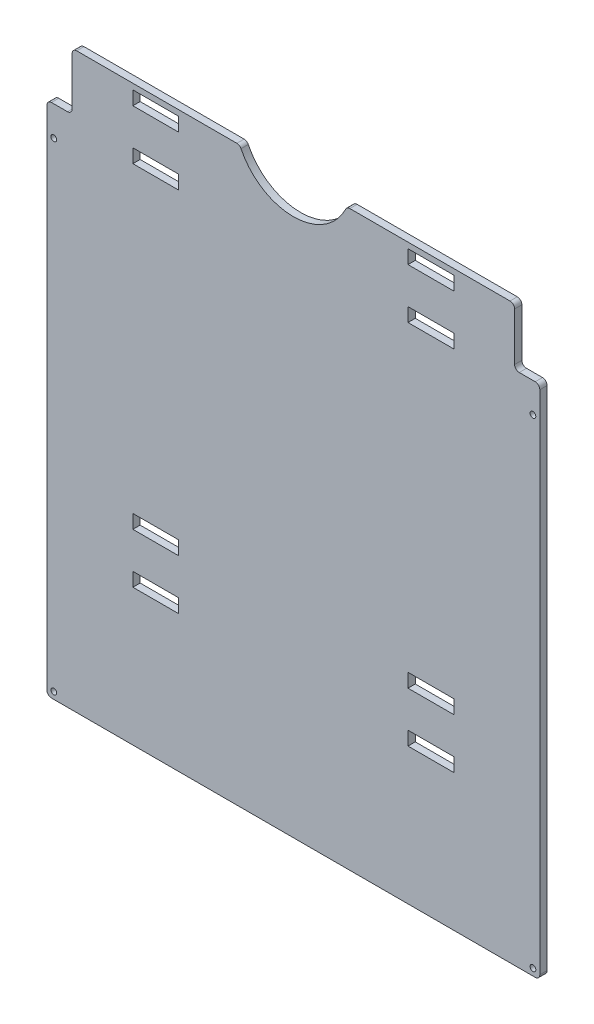
from build123d import *

# Parameters (mm, degrees)
SKETCH1_W                 = 215
SKETCH1_H                 = 250
BOSS_EXTRUDE1_DEPTH       = 3.175
SKETCH2_R                 = 25.4
CUT_EXTRUDE1_DEPTH        = 165.897940027
SKETCH3_W                 = 11
SKETCH3_H                 = 25
CUT_EXTRUDE2_DEPTH        = 165.897940027
FILLET1_R                 = 2
SKETCH4_W                 = 20
SKETCH4_H                 = 6
CUT_EXTRUDE3_DEPTH        = 165.897940027
LPATTERN1_COUNT           = 2
LPATTERN1_PITCH           = 160
LPATTERN1_COPY_1_SKETCH_W = 20
LPATTERN1_COPY_1_SKETCH_H = 6
LPATTERN1_COPY_1_DEPTH    = 165.897940027
M3X0_5_TAPPED_HOLE1_D     = 2.5


with BuildPart() as part:
    # Sketch1 → Boss-Extrude1 (new body)
    with BuildSketch(Plane.XY):
        Rectangle(SKETCH1_W, SKETCH1_H)
    extrude(amount=BOSS_EXTRUDE1_DEPTH)

    # Sketch2 → Cut-Extrude1 (cut, through all)
    with BuildSketch(Plane.XY.offset(3.175)):
        with Locations((0, 135)):
            Circle(SKETCH2_R)
    extrude(amount=-CUT_EXTRUDE1_DEPTH, mode=Mode.SUBTRACT)

    # Sketch3 → Cut-Extrude2 (cut, through all)
    with BuildSketch(Plane.XY.offset(3.175)):
        with Locations((-102, 112.5)):
            Rectangle(SKETCH3_W, SKETCH3_H)
    cut_extrude2 = extrude(amount=-CUT_EXTRUDE2_DEPTH, mode=Mode.SUBTRACT)

    # Mirror1: Cut-Extrude2 across plane
    add(cut_extrude2.mirror(Plane(origin=(0, 0, 0), x_dir=(0, 0, 1), z_dir=(1, 0, 0))), mode=Mode.SUBTRACT)

    # Fillet1
    fillet1_edges = [part.edges().sort_by_distance(p)[0] for p in [
        (107.5, 100, 1.5875),
        (107.5, -125, 1.5875),
        (-107.5, -125, 1.5875),
        (-107.5, 100, 1.5875),
        (-96.5, 100, 1.5875),
        (23.348661632, 125, 1.5875),
        (96.5, 125, 1.5875),
        (96.5, 100, 1.5875),
        (-23.348661632, 125, 1.5875),
        (-96.5, 125, 1.5875),
    ]]
    fillet(fillet1_edges, radius=FILLET1_R)

    # Sketch4 → Cut-Extrude3 (cut, through all)
    with BuildSketch(Plane(origin=(0, 0, 0), x_dir=(-1, 0, 0), z_dir=(0, 0, -1))):
        with Locations((-60, -40.5)):
            Rectangle(SKETCH4_W, SKETCH4_H)
        with Locations((-60, -62.375)):
            Rectangle(SKETCH4_W, SKETCH4_H)
    cut_extrude3 = extrude(amount=-CUT_EXTRUDE3_DEPTH, mode=Mode.SUBTRACT)

    # Mirror2: Cut-Extrude3 across plane
    add(cut_extrude3.mirror(Plane(origin=(0, 0, 0), x_dir=(0, 0, 1), z_dir=(1, 0, 0))), mode=Mode.SUBTRACT)

    # LPattern1: Cut-Extrude3 ×2
    with Locations(*[(0, i * LPATTERN1_PITCH, 0) for i in range(1, LPATTERN1_COUNT)]):
        add(cut_extrude3, mode=Mode.SUBTRACT)

    # LPattern1 copy 1 sketch → LPattern1 copy 1 (cut, through all)
    with BuildSketch(Plane(origin=(0, 160, 0), x_dir=(1, 0, 0), z_dir=(0, 0, -1))):
        with Locations((-60, 40.5)):
            Rectangle(LPATTERN1_COPY_1_SKETCH_W, LPATTERN1_COPY_1_SKETCH_H)
        with Locations((-60, 62.375)):
            Rectangle(LPATTERN1_COPY_1_SKETCH_W, LPATTERN1_COPY_1_SKETCH_H)
    extrude(amount=-LPATTERN1_COPY_1_DEPTH, mode=Mode.SUBTRACT)

    # M3x0.5 Tapped Hole1 (through all)
    with Locations(Plane(origin=(0, 0, 0), x_dir=(-1, 0, 0), z_dir=(0, 0, -1))):
        with Locations((-104.5, 87), (104.5, 87), (104.5, -122), (-104.5, -122)):
            Hole(M3X0_5_TAPPED_HOLE1_D / 2)


solid = part.part
